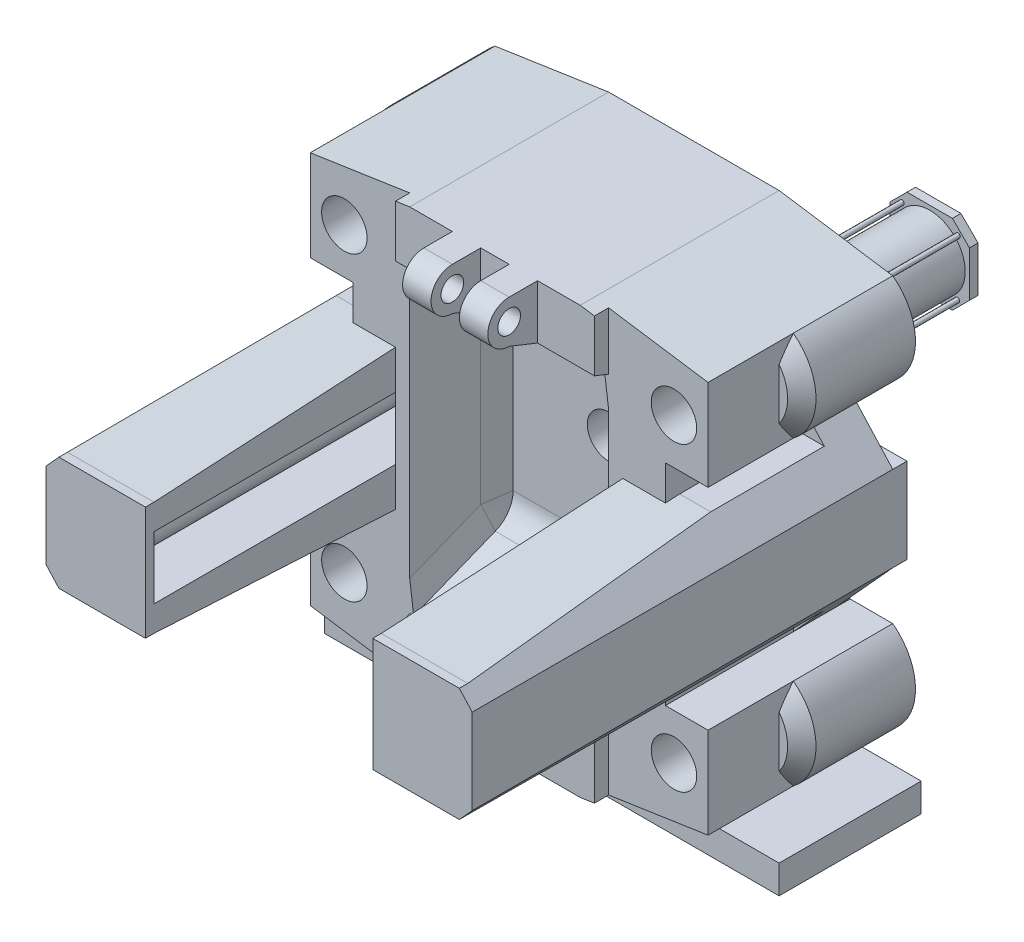
from build123d import *
from OCP.BRepFilletAPI import BRepFilletAPI_MakeChamfer

# Parameters (mm, degrees)
SKETCH1_W                      = 1400
SKETCH1_H                      = 1500
BOSS_EXTRUDE1_DEPTH            = 800
SKETCH2_R                      = 80
CUT_EXTRUDE1_DEPTH             = 800
BOSS_EXTRUDE2_START            = -400
SKETCH3_R                      = 200
SKETCH3_R_2                    = 80
BOSS_EXTRUDE2_DEPTH            = 400
CHAMFER1_SIZE                  = 50
CHAMFER2_SIZE                  = 50
CUT_EXTRUDE2_DEPTH             = 960
MIRROR2_COPY_1_DEPTH           = 960
SKETCH5_W                      = 447.063619531
SKETCH5_H                      = 1621.646918051
CUT_EXTRUDE3_DEPTH             = 150
SKETCH6_W                      = 300
SKETCH6_H                      = 300
CUT_EXTRUDE4_DEPTH             = 975
SKETCH7_W                      = 150
SKETCH7_H                      = 740
CUT_EXTRUDE5_DEPTH             = 975
SKETCH8_W                      = 350
SKETCH8_H                      = 300
BOSS_EXTRUDE3_DEPTH            = 100
BOSS_EXTRUDE4_DEPTH            = 100
BOSS_EXTRUDE5_DEPTH            = 150
MIRROR7_COPY_1_DEPTH           = 150
SKETCH11_R                     = 110
BOSS_EXTRUDE9_DEPTH            = 50
SKETCH12_R                     = 60
BOSS_EXTRUDE10_DEPTH           = 1350
LPATTERN1_START                = 150
LPATTERN1_OUTLINE_R            = 60
LPATTERN1_DEPTH                = 1350
LPATTERN1_START_2              = 100
LPATTERN1_2_OUTLINE_R          = 110
LPATTERN1_2_DEPTH              = 50
CUT_EXTRUDE7_REACH             = 1851.568
CUT_EXTRUDE7_DIRECTION_2_REACH = 1851.568
FILLET3_R                      = 100
CHAMFER3_SIZE                  = 100
CHAMFER3_SIZE_2                = 14.05408347
CHAMFER4_SIZE                  = 14.05408347
CHAMFER4_SIZE_2                = 100
BOSS_EXTRUDE11_DEPTH           = 700
CUT_EXTRUDE8_DEPTH             = 700
SKETCH19_R                     = 40
CUT_EXTRUDE10_DEPTH            = 783
BOSS_EXTRUDE12_DEPTH           = 500
BOSS_EXTRUDE14_DEPTH           = 1300
CHAMFER9_SIZE                  = 900
CHAMFER9_SIZE2                 = 50
CHAMFER10_SIZE                 = 50
CHAMFER10_SIZE2                = 900
CHAMFER11_SIZE                 = 900
CHAMFER11_SIZE2                = 50
CHAMFER12_SIZE                 = 50
CHAMFER12_SIZE2                = 900
BOSS_EXTRUDE16_DEPTH           = 30
SKETCH25_W                     = 264.856828154
SKETCH25_H                     = 334.690232982
CUT_EXTRUDE11_DEPTH            = 50
CUT_EXTRUDE12_START            = -100
CUT_EXTRUDE12_DEPTH            = 268
MIRROR42_START                 = -100
MIRROR42_COPY_1_DEPTH          = 268
SKETCH27_R                     = 75
CUT_EXTRUDE13_DEPTH            = 1334
SKETCH28_R                     = 180
SKETCH28_R_2                   = 50
BOSS_EXTRUDE17_DEPTH           = 30
SKETCH29_R                     = 125
SKETCH29_R_2                   = 100
BOSS_EXTRUDE18_DEPTH           = 800
SKETCH30_W                     = 280
SKETCH30_H                     = 280
BOSS_EXTRUDE19_DEPTH           = 30
CHAMFER13_SIZE                 = 60
SKETCH31_R                     = 8
BOSS_EXTRUDE20_DEPTH           = 845
CIRPATTERN1_COUNT              = 4


# Read off the part's stored shape, not the designer's step: LPattern1
with BuildPart() as part:
    # Sketch1 → Boss-Extrude1 (new body)
    with BuildSketch(Plane.XY):
        Rectangle(SKETCH1_W, SKETCH1_H)
    extrude(amount=BOSS_EXTRUDE1_DEPTH)

    # Sketch2 → Cut-Extrude1 (cut)
    with BuildSketch(Plane.XY.offset(800)):
        with Locations((-580, 530)):
            Circle(SKETCH2_R)
        with Locations((580, 530)):
            Circle(SKETCH2_R)
        with Locations(Location((580, -530, 0), (0, 0, 180))):
            Circle(SKETCH2_R)
        with Locations(Location((-580, -530, 0), (0, 0, 180))):
            Circle(SKETCH2_R)
    extrude(amount=-CUT_EXTRUDE1_DEPTH, mode=Mode.SUBTRACT)

    # Sketch3 → Boss-Extrude2 (add)
    # profile 1 of 4: a face of its own
    with BuildSketch(Plane(origin=(0, 0, 0), x_dir=(-1, 0, 0), z_dir=(0, 0, -1)).offset(BOSS_EXTRUDE2_START)):
        with Locations((-580, -530)):
            Circle(SKETCH3_R)
        with Locations((-580, -530)):
            Circle(SKETCH3_R_2, mode=Mode.SUBTRACT)
    # profile 2 of 4: a face of its own
    with BuildSketch(Plane(origin=(0, 0, 0), x_dir=(-1, 0, 0), z_dir=(0, 0, -1)).offset(BOSS_EXTRUDE2_START)):
        with Locations((-580, 530)):
            Circle(SKETCH3_R)
        with Locations(Location((-580, 530, 0), (0, 0, 180))):
            Circle(SKETCH3_R_2, mode=Mode.SUBTRACT)
    # profile 3 of 4: a face of its own
    with BuildSketch(Plane(origin=(0, 0, 0), x_dir=(-1, 0, 0), z_dir=(0, 0, -1)).offset(BOSS_EXTRUDE2_START)):
        with Locations((580, 530)):
            Circle(SKETCH3_R)
        with Locations(Location((580, 530, 0), (0, 0, 180))):
            Circle(SKETCH3_R_2, mode=Mode.SUBTRACT)
    # profile 4 of 4: a face of its own
    with BuildSketch(Plane(origin=(0, 0, 0), x_dir=(-1, 0, 0), z_dir=(0, 0, -1)).offset(BOSS_EXTRUDE2_START)):
        with Locations((580, -530)):
            Circle(SKETCH3_R)
        with Locations((580, -530)):
            Circle(SKETCH3_R_2, mode=Mode.SUBTRACT)
    extrude(amount=BOSS_EXTRUDE2_DEPTH)

    # Chamfer1
    chamfer1_edges = [part.edges().sort_by_distance(p)[0] for p in [
        (-780, 530, 400),
    ]]
    chamfer(chamfer1_edges, length=CHAMFER1_SIZE)

    # Chamfer2
    chamfer2_edges = [part.edges().sort_by_distance(p)[0] for p in [
        (780, -530, 400),
        (780, 530, 400),
        (-780, -530, 400),
    ]]
    chamfer(chamfer2_edges, length=CHAMFER2_SIZE)

    # Sketch4 → Cut-Extrude2 (cut)
    with BuildSketch(Plane(origin=(0, 0, 0), x_dir=(-1, 0, 0), z_dir=(0, 0, -1))):
        Polygon((-700, 750), (-300, 750), (-700, 690), align=None)
    cut_extrude2 = extrude(amount=-CUT_EXTRUDE2_DEPTH, mode=Mode.SUBTRACT)

    # Mirror1: Cut-Extrude2 across plane
    add(cut_extrude2.mirror(Plane.ZY), mode=Mode.SUBTRACT)

    # Mirror2: Cut-Extrude2 across plane
    add(cut_extrude2.mirror(Plane(origin=(0, 0, 0), x_dir=(0, 0, 1), z_dir=(0, -1, 0))), mode=Mode.SUBTRACT)

    # Mirror2 copy 1 sketch → Mirror2 copy 1 (cut)
    with BuildSketch(Plane(origin=(0, 0, 0), x_dir=(1, 0, 0), z_dir=(0, 0, -1))):
        Polygon((-700, 750), (-300, 750), (-700, 690), align=None)
    extrude(amount=-MIRROR2_COPY_1_DEPTH, mode=Mode.SUBTRACT)

    # Sketch5 → Cut-Extrude3 (cut)
    with BuildSketch(Plane.XY.offset(800)):
        with Locations((-573.531809766, -15.272359673)):
            Rectangle(SKETCH5_W, SKETCH5_H)
    cut_extrude3 = extrude(amount=-CUT_EXTRUDE3_DEPTH, mode=Mode.SUBTRACT)

    # Mirror3: Cut-Extrude3 across plane
    add(cut_extrude3.mirror(Plane.ZY), mode=Mode.SUBTRACT)

    # Sketch6 → Cut-Extrude4 (cut)
    with BuildSketch(Plane.XY.offset(650)):
        with Locations((-550, 0)):
            Rectangle(SKETCH6_W, SKETCH6_H)
    cut_extrude4 = extrude(amount=-CUT_EXTRUDE4_DEPTH, mode=Mode.SUBTRACT)

    # Mirror4: Cut-Extrude4 across plane
    add(cut_extrude4.mirror(Plane.ZY), mode=Mode.SUBTRACT)

    # Sketch7 → Cut-Extrude5 (cut)
    with BuildSketch(Plane.XY.offset(650)):
        with Locations((-625, 0)):
            Rectangle(SKETCH7_W, SKETCH7_H)
    cut_extrude5 = extrude(amount=-CUT_EXTRUDE5_DEPTH, mode=Mode.SUBTRACT)

    # Mirror5: Cut-Extrude5 across plane
    add(cut_extrude5.mirror(Plane.ZY), mode=Mode.SUBTRACT)

    # Sketch8 → Boss-Extrude3 (add)
    with BuildSketch(Plane(origin=(0, 0, 0), x_dir=(-1, 0, 0), z_dir=(0, 0, -1))):
        with Locations((575, 0)):
            Rectangle(SKETCH8_W, SKETCH8_H)
    boss_extrude3 = extrude(amount=-BOSS_EXTRUDE3_DEPTH)

    # Sketch9 → Boss-Extrude4 (add)
    with BuildSketch(Plane.XY.offset(100)):
        Polygon((-400, 150), (-710, 150), (-750, 150), (-750, -150), (-400, -150), (-400, -110), (-710, -110), (-710, 110), (-400, 110), align=None)
    boss_extrude4 = extrude(amount=BOSS_EXTRUDE4_DEPTH)

    # Sketch10 → Boss-Extrude5 (add)
    with BuildSketch(Plane.XY.offset(200)):
        Polygon((-750, 150), (-550, 370), (-550, 150), align=None)
    boss_extrude5 = extrude(amount=-BOSS_EXTRUDE5_DEPTH)

    # Mirror6: Boss-Extrude5 across plane
    add(boss_extrude5.mirror(Plane(origin=(0, 0, 0), x_dir=(0, 0, 1), z_dir=(0, -1, 0))))

    # Mirror7: Boss-Extrude3, Boss-Extrude4, Boss-Extrude5 across plane
    add(boss_extrude3.mirror(Plane.ZY))
    add(boss_extrude4.mirror(Plane.ZY))
    add(boss_extrude5.mirror(Plane.ZY))

    # Mirror7 copy 1 sketch → Mirror7 copy 1 (add)
    with BuildSketch(Plane(origin=(0, 0, 200), x_dir=(-1, 0, 0), z_dir=(0, 0, 1))):
        Polygon((-750, 150), (-550, 370), (-550, 150), align=None)
    extrude(amount=-MIRROR7_COPY_1_DEPTH)

    # Cut-Extrude7: up to this face of the body (flat: up to its plane)
    cut_extrude7_end = Plane(part.part.faces().sort_by_distance((350, 0, 725))[0])
    # Sketch14 → Cut-Extrude7 (cut, up to the picked face)
    with BuildSketch(Plane.ZY, mode=Mode.PRIVATE) as cut_extrude7_sk1:
        Polygon((800, 600), (800, -600), (300, -400), (300, 400), align=None)
    cut_extrude7_tool1 = split(extrude(cut_extrude7_sk1.sketch, amount=-CUT_EXTRUDE7_REACH, mode=Mode.PRIVATE), bisect_by=cut_extrude7_end, keep=Keep.BOTH, mode=Mode.PRIVATE)
    add(cut_extrude7_tool1.solids().sort_by(Axis((0, 0, 566.666667), (1, 0, 0)))[0], mode=Mode.SUBTRACT)

    # Cut-Extrude7 direction 2: up to this face of the body (flat: up to its plane)
    cut_extrude7_direction_2_end = Plane(part.part.faces().sort_by_distance((-350, 0, 725))[0])
    # Sketch14 → Cut-Extrude7 direction 2 (cut, up to the picked face)
    with BuildSketch(Plane.ZY, mode=Mode.PRIVATE) as cut_extrude7_direction_2_sk1:
        Polygon((800, 600), (800, -600), (300, -400), (300, 400), align=None)
    cut_extrude7_direction_2_tool1 = split(extrude(cut_extrude7_direction_2_sk1.sketch, amount=CUT_EXTRUDE7_DIRECTION_2_REACH, mode=Mode.PRIVATE), bisect_by=cut_extrude7_direction_2_end, keep=Keep.BOTH, mode=Mode.PRIVATE)
    add(cut_extrude7_direction_2_tool1.solids().sort_by(Axis((0, 0, 566.666667), (-1, 0, 0)))[0], mode=Mode.SUBTRACT)

    # Fillet3
    fillet3_edges = [part.edges().sort_by_distance(p)[0] for p in [
        (0, 400, 300),
        (0, -400, 300),
    ]]
    fillet(fillet3_edges, radius=FILLET3_R)

    # Chamfer3
    chamfer3_edges_1 = [part.edges().sort_by_distance(p)[0] for p in [
        (-350, -482.572186473, 506.430466182),
    ]]
    chamfer3_side_1 = [part.faces().sort_by_distance(p)[0] for p in [
        (-350, -482.311208695, 506.534857294),
    ]]
    chamfer3_edges_2 = [part.edges().sort_by_distance(p)[0] for p in [
        (-350, 0, 300),
    ]]
    chamfer3_side_2 = [part.faces().sort_by_distance(p)[0] for p in [
        (-350, 0, 300.281081669),
    ]]
    chamfer3_edges_3 = [part.edges().sort_by_distance(p)[0] for p in [
        (-350, 482.572186473, 506.430466182),
    ]]
    chamfer3_side_3 = [part.faces().sort_by_distance(p)[0] for p in [
        (-349.718918331, 482.572186473, 506.430466182),
    ]]
    chamfer3_edges_4 = [part.edges().sort_by_distance(p)[0] for p in [
        (-350, 388.359584788, 317.193276953),
    ]]
    chamfer3_side_4 = [part.faces().sort_by_distance(p)[0] for p in [
        (-349.718918331, 388.359584788, 317.193276953),
    ]]
    chamfer3_edges_5 = [part.edges().sort_by_distance(p)[0] for p in [
        (-350, -388.359584788, 317.193276953),
    ]]
    chamfer3_side_5 = [part.faces().sort_by_distance(p)[0] for p in [
        (-350, -388.202002306, 317.426031473),
    ]]
    chamfer3 = BRepFilletAPI_MakeChamfer(part.part.solid().wrapped)
    for e in chamfer3_edges_1:
        chamfer3.Add(CHAMFER3_SIZE - 0.0001, CHAMFER3_SIZE_2 - 0.0001, e.wrapped, chamfer3_side_1[0].wrapped)
    for e in chamfer3_edges_2:
        chamfer3.Add(CHAMFER3_SIZE - 0.0001, CHAMFER3_SIZE_2 - 0.0001, e.wrapped, chamfer3_side_2[0].wrapped)
    for e in chamfer3_edges_3:
        chamfer3.Add(CHAMFER3_SIZE_2 - 0.0001, CHAMFER3_SIZE - 0.0001, e.wrapped, chamfer3_side_3[0].wrapped)
    for e in chamfer3_edges_4:
        chamfer3.Add(CHAMFER3_SIZE_2 - 0.0001, CHAMFER3_SIZE - 0.0001, e.wrapped, chamfer3_side_4[0].wrapped)
    for e in chamfer3_edges_5:
        chamfer3.Add(CHAMFER3_SIZE - 0.0001, CHAMFER3_SIZE_2 - 0.0001, e.wrapped, chamfer3_side_5[0].wrapped)
    add(Compound.cast(chamfer3.Shape()), mode=Mode.REPLACE)  # a hair under: the kernel refuses the full size

    # Chamfer4
    chamfer4_edges_1 = [part.edges().sort_by_distance(p)[0] for p in [
        (350, 482.572186473, 506.430466182),
    ]]
    chamfer4_side_1 = [part.faces().sort_by_distance(p)[0] for p in [
        (349.718918331, 482.572186473, 506.430466182),
    ]]
    chamfer4_edges_2 = [part.edges().sort_by_distance(p)[0] for p in [
        (350, -482.572186473, 506.430466182),
    ]]
    chamfer4_side_2 = [part.faces().sort_by_distance(p)[0] for p in [
        (350, -482.311208695, 506.534857294),
    ]]
    chamfer4_edges_3 = [part.edges().sort_by_distance(p)[0] for p in [
        (350, 0, 300),
    ]]
    chamfer4_side_3 = [part.faces().sort_by_distance(p)[0] for p in [
        (350, 0, 300.281081669),
    ]]
    chamfer4_edges_4 = [part.edges().sort_by_distance(p)[0] for p in [
        (350, 388.359584788, 317.193276953),
    ]]
    chamfer4_side_4 = [part.faces().sort_by_distance(p)[0] for p in [
        (349.718918331, 388.359584788, 317.193276953),
    ]]
    chamfer4_edges_5 = [part.edges().sort_by_distance(p)[0] for p in [
        (350, -388.359584788, 317.193276953),
    ]]
    chamfer4_side_5 = [part.faces().sort_by_distance(p)[0] for p in [
        (350, -388.202002306, 317.426031473),
    ]]
    chamfer4 = BRepFilletAPI_MakeChamfer(part.part.solid().wrapped)
    for e in chamfer4_edges_1:
        chamfer4.Add(CHAMFER4_SIZE - 0.0001, CHAMFER4_SIZE_2 - 0.0001, e.wrapped, chamfer4_side_1[0].wrapped)
    for e in chamfer4_edges_2:
        chamfer4.Add(CHAMFER4_SIZE_2 - 0.0001, CHAMFER4_SIZE - 0.0001, e.wrapped, chamfer4_side_2[0].wrapped)
    for e in chamfer4_edges_3:
        chamfer4.Add(CHAMFER4_SIZE_2 - 0.0001, CHAMFER4_SIZE - 0.0001, e.wrapped, chamfer4_side_3[0].wrapped)
    for e in chamfer4_edges_4:
        chamfer4.Add(CHAMFER4_SIZE - 0.0001, CHAMFER4_SIZE_2 - 0.0001, e.wrapped, chamfer4_side_4[0].wrapped)
    for e in chamfer4_edges_5:
        chamfer4.Add(CHAMFER4_SIZE_2 - 0.0001, CHAMFER4_SIZE - 0.0001, e.wrapped, chamfer4_side_5[0].wrapped)
    add(Compound.cast(chamfer4.Shape()), mode=Mode.REPLACE)  # a hair under: the kernel refuses the full size

    # Sketch15 → Boss-Extrude11 (add)
    with BuildSketch(Plane.ZY.offset(350)):
        with BuildLine():
            Line((800, 600), (800, 750))
            ThreePointArc((800, 750), (875, 675), (800, 600))
        make_face()
    boss_extrude11 = extrude(amount=-BOSS_EXTRUDE11_DEPTH)

    # Sketch16 → Cut-Extrude8 (cut)
    with BuildSketch(Plane(origin=(0, 0, 800), x_dir=(-1, 0, 0), z_dir=(0, 0, -1))):
        Polygon((-350, 742.5), (-300, 750), (-350, 750), align=None)
        Polygon((350, 750), (300, 750), (350, 742.5), align=None)
    cut_extrude8 = extrude(amount=-CUT_EXTRUDE8_DEPTH, mode=Mode.SUBTRACT)

    # Mirror28: Boss-Extrude11, Cut-Extrude8 across plane
    add(boss_extrude11.mirror(Plane(origin=(0, 0, 0), x_dir=(0, 0, 1), z_dir=(0, -1, 0))))
    add(cut_extrude8.mirror(Plane(origin=(0, 0, 0), x_dir=(0, 0, 1), z_dir=(0, -1, 0))), mode=Mode.SUBTRACT)

    # Sketch19 → Cut-Extrude10 (cut)
    with BuildSketch(Plane.ZY.offset(350)):
        with Locations(Location((800, 675, 0), (0, 0, 270))):
            Circle(SKETCH19_R)
    cut_extrude10 = extrude(amount=-CUT_EXTRUDE10_DEPTH, mode=Mode.SUBTRACT)

    # Mirror31: Cut-Extrude10 across plane
    add(cut_extrude10.mirror(Plane(origin=(0, 0, 0), x_dir=(0, 0, 1), z_dir=(0, -1, 0))), mode=Mode.SUBTRACT)

    # Sketch20 → Boss-Extrude12 (add)
    with BuildSketch(Plane(origin=(0, 0, 0), x_dir=(-1, 0, 0), z_dir=(0, 0, -1))):
        Polygon((0, -750), (0, -900), (800, -900), (800, -800), (580, -800), (500, -720), align=None)
    boss_extrude12 = extrude(amount=-BOSS_EXTRUDE12_DEPTH)

    # Mirror32: Boss-Extrude12 across plane
    add(boss_extrude12.mirror(Plane.ZY))

    # Sketch22 → Boss-Extrude14 (add)
    with BuildSketch(Plane.XY.offset(200)):
        Polygon((-400, 150), (-400, 250), (-659.090909091, 250), (-750, 150), (-750, -150), (-659.090909091, -250), (-400, -250), (-400, -150), (-400, -110), (-710, -110), (-710, 110), (-400, 110), align=None)
    boss_extrude14 = extrude(amount=BOSS_EXTRUDE14_DEPTH)

    # Mirror36: Boss-Extrude14 across plane
    add(boss_extrude14.mirror(Plane.ZY))

    # Chamfer9
    chamfer9_edges = [part.edges().sort_by_distance(p)[0] for p in [
        (-529.545454545, 250, 1500),
    ]]
    chamfer9_side = [part.faces().sort_by_distance(p)[0] for p in [
        (-543.216340621, 250, 956.518987342),
    ]]
    chamfer(chamfer9_edges, length=CHAMFER9_SIZE, length2=CHAMFER9_SIZE2, reference=chamfer9_side[0])

    # Chamfer10
    chamfer10_edges = [part.edges().sort_by_distance(p)[0] for p in [
        (529.545454545, 250, 1500),
    ]]
    chamfer10_side = [part.faces().sort_by_distance(p)[0] for p in [
        (406.103277808, 180, 1500),
    ]]
    chamfer(chamfer10_edges, length=CHAMFER10_SIZE, length2=CHAMFER10_SIZE2, reference=chamfer10_side[0])

    # Chamfer11
    chamfer11_edges = [part.edges().sort_by_distance(p)[0] for p in [
        (-529.545454545, -250, 1500),
    ]]
    chamfer11_side = [part.faces().sort_by_distance(p)[0] for p in [
        (-543.216340621, -250, 956.518987342),
    ]]
    chamfer(chamfer11_edges, length=CHAMFER11_SIZE, length2=CHAMFER11_SIZE2, reference=chamfer11_side[0])

    # Chamfer12
    chamfer12_edges = [part.edges().sort_by_distance(p)[0] for p in [
        (529.545454545, -250, 1500),
    ]]
    chamfer12_side = [part.faces().sort_by_distance(p)[0] for p in [
        (405.700877125, 155, 1500),
    ]]
    chamfer(chamfer12_edges, length=CHAMFER12_SIZE, length2=CHAMFER12_SIZE2, reference=chamfer12_side[0])

    # Sketch24 → Boss-Extrude16 (add)
    with BuildSketch(Plane.XY.offset(1500)):
        Polygon((-400, 110), (-400, -110), (-400, -200), (-704.545454545, -200), (-750, -150), (-750, 150), (-704.545454545, 200), (-400, 200), align=None)
    boss_extrude16 = extrude(amount=BOSS_EXTRUDE16_DEPTH)

    # Mirror40: Boss-Extrude16 across plane
    add(boss_extrude16.mirror(Plane.ZY))

    # Sketch25 → Cut-Extrude11 (cut, symmetric)
    with BuildSketch(Plane.ZY):
        with Locations((832.428414077, 707.345116491)):
            Rectangle(SKETCH25_W, SKETCH25_H)
    cut_extrude11 = extrude(amount=CUT_EXTRUDE11_DEPTH, both=True, mode=Mode.SUBTRACT)

    # Sketch26 → Cut-Extrude12 (cut)
    with BuildSketch(Plane.ZY.offset(-50).offset(CUT_EXTRUDE12_START)):
        with BuildLine():
            Line((700, 750), (700, 560))
            Line((700, 560), (800, 600))
            ThreePointArc((800, 600), (875, 675), (800, 750))
            Line((800, 750), (700, 750))
        make_face()
    cut_extrude12 = extrude(amount=-CUT_EXTRUDE12_DEPTH, mode=Mode.SUBTRACT)

    # Mirror41: Cut-Extrude12 across plane
    add(cut_extrude12.mirror(Plane.ZY), mode=Mode.SUBTRACT)

    # Mirror42: Cut-Extrude11, Cut-Extrude12 across plane
    add(cut_extrude11.mirror(Plane(origin=(0, 0, 0), x_dir=(0, 0, 1), z_dir=(0, -1, 0))), mode=Mode.SUBTRACT)
    add(cut_extrude12.mirror(Plane(origin=(0, 0, 0), x_dir=(0, 0, 1), z_dir=(0, -1, 0))), mode=Mode.SUBTRACT)

    # Mirror42 copy 1 sketch → Mirror42 copy 1 (cut)
    with BuildSketch(Plane(origin=(-50, 0, 0), x_dir=(0, 0, 1), z_dir=(1, 0, 0)).offset(MIRROR42_START)):
        with BuildLine():
            Line((700, 750), (700, 560))
            Line((700, 560), (800, 600))
            ThreePointArc((800, 600), (875, 675), (800, 750))
            Line((800, 750), (700, 750))
        make_face()
    extrude(amount=-MIRROR42_COPY_1_DEPTH, mode=Mode.SUBTRACT)

    # Sketch27 → Cut-Extrude13 (cut)
    with BuildSketch(Plane(origin=(0, 0, 0), x_dir=(-1, 0, 0), z_dir=(0, 0, -1))):
        Circle(SKETCH27_R)
    extrude(amount=-CUT_EXTRUDE13_DEPTH, mode=Mode.SUBTRACT)

    # Sketch28 → Boss-Extrude17 (add)
    with BuildSketch(Plane(origin=(0, 0, 0), x_dir=(-1, 0, 0), z_dir=(0, 0, -1))):
        with Locations(Location((0, 0, 0), (0, 0, 180))):
            Circle(SKETCH28_R)
        Circle(SKETCH28_R_2, mode=Mode.SUBTRACT)
    extrude(amount=BOSS_EXTRUDE17_DEPTH)

    # Sketch29 → Boss-Extrude18 (add)
    with BuildSketch(Plane(origin=(0, 0, -30), x_dir=(-1, 0, 0), z_dir=(0, 0, -1))):
        Circle(SKETCH29_R)
        Circle(SKETCH29_R_2, mode=Mode.SUBTRACT)
    extrude(amount=BOSS_EXTRUDE18_DEPTH)

    # Sketch30 → Boss-Extrude19 (add)
    with BuildSketch(Plane(origin=(0, 0, -830), x_dir=(-1, 0, 0), z_dir=(0, 0, -1))):
        Rectangle(SKETCH30_W, SKETCH30_H)
    extrude(amount=BOSS_EXTRUDE19_DEPTH)

    # Chamfer13
    chamfer13_edges = [part.edges().sort_by_distance(p)[0] for p in [
        (-140, -140, -845),
        (-140, 140, -845),
        (140, 140, -845),
        (140, -140, -845),
    ]]
    chamfer(chamfer13_edges, length=CHAMFER13_SIZE)

    # Sketch31 → Boss-Extrude20 (add)
    with BuildSketch(Plane.XY.offset(-830)):
        with Locations(Location((99.601387061, 97.629908083, 0), (0, 0, 180))):
            Circle(SKETCH31_R)
    boss_extrude20 = extrude(amount=BOSS_EXTRUDE20_DEPTH)

    # CirPattern1: Boss-Extrude20 ×4 about axis
    cirpattern1_axis = Axis((0, 0, 0), (0, 0, 1))
    for i in range(1, CIRPATTERN1_COUNT):
        add(boss_extrude20.rotate(cirpattern1_axis, i * 360 / CIRPATTERN1_COUNT))


with BuildPart() as body_2:
    # Sketch11 → Boss-Extrude9 (new body)
    with BuildSketch(Plane.XY.offset(100)):
        with Locations((-552.581740911, 0)):
            Circle(SKETCH11_R)
    extrude(amount=BOSS_EXTRUDE9_DEPTH)


with BuildPart() as body_3:
    # Sketch12 → Boss-Extrude10 (new body)
    with BuildSketch(Plane.XY.offset(150)):
        with Locations((-552.581740911, 0)):
            Circle(SKETCH12_R)
    extrude(amount=BOSS_EXTRUDE10_DEPTH)


with BuildPart() as body_4:
    # LPattern1 outline → LPattern1 (new body)
    with BuildSketch(Plane.XY.offset(LPATTERN1_START)):
        with Locations((554.418259089, 0)):
            Circle(LPATTERN1_OUTLINE_R)
    extrude(amount=LPATTERN1_DEPTH)


with BuildPart() as body_5:
    # LPattern1 2 outline → LPattern1 2 (new body)
    with BuildSketch(Plane.XY.offset(LPATTERN1_START_2)):
        with Locations((554.418259089, 0)):
            Circle(LPATTERN1_2_OUTLINE_R)
    extrude(amount=LPATTERN1_2_DEPTH)


solid = Compound([part.part, body_2.part, body_3.part, body_4.part, body_5.part])
